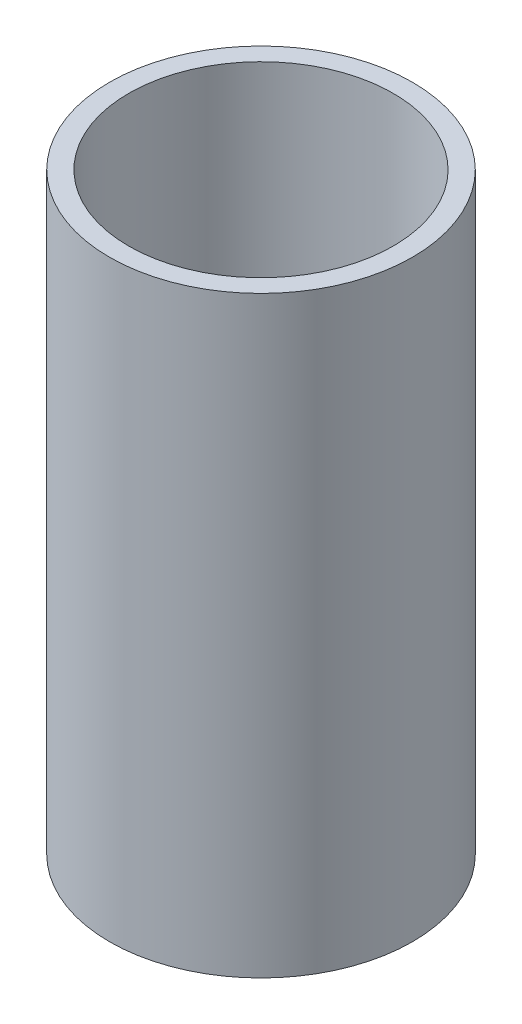
from build123d import *

# Parameters (mm, degrees)
SKETCH1_R           = 35
BOSS_EXTRUDE1_DEPTH = 136.940976702
SKETCH2_R           = 30.56081616
CUT_EXTRUDE1_DEPTH  = 146.611919499


with BuildPart() as part:
    # Sketch1 → Boss-Extrude1 (new body)
    with BuildSketch(Plane(origin=(0, 0, 0), x_dir=(1, 0, 0), z_dir=(0, 1, 0))):
        Circle(SKETCH1_R)
    extrude(amount=BOSS_EXTRUDE1_DEPTH)

    # Sketch2 → Cut-Extrude1 (cut, through all)
    with BuildSketch(Plane(origin=(0, 0, 0), x_dir=(1, 0, 0), z_dir=(0, 1, 0))):
        Circle(SKETCH2_R)
    extrude(amount=CUT_EXTRUDE1_DEPTH, mode=Mode.SUBTRACT)


solid = part.part
